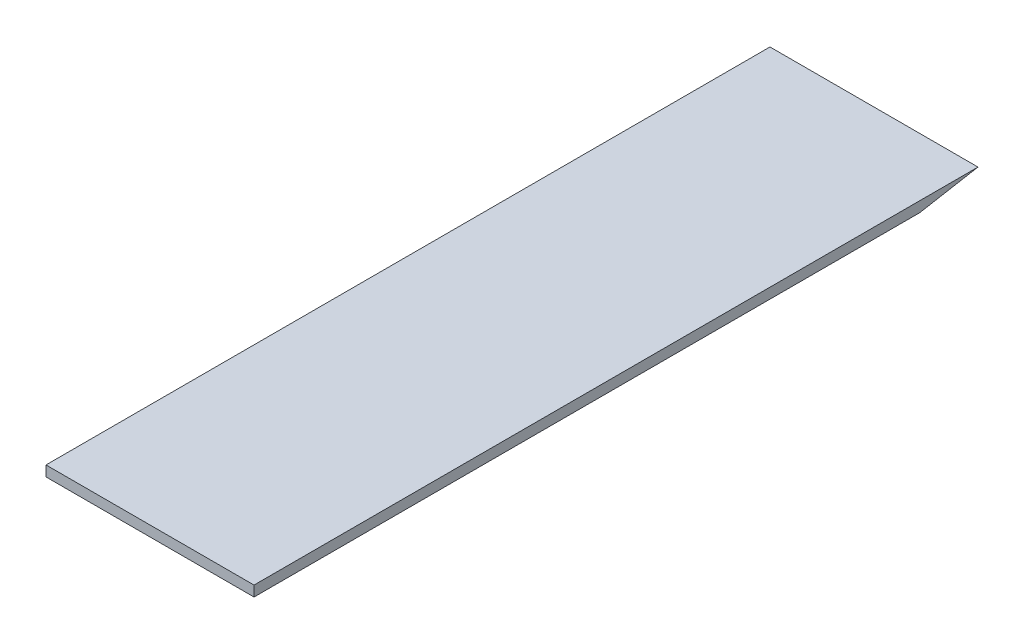
from build123d import *

# Parameters (mm, degrees)
BOSS_EXTRUDE1_DEPTH = 100


with BuildPart() as part:
    # Sketch1 → Boss-Extrude1 (new body)
    with BuildSketch(Plane(origin=(0, 0, 0), x_dir=(0, 0, -1), z_dir=(1, 0, 0))):
        Polygon((0, 5), (0, 0), (320, 0), (348, 5), align=None)
    extrude(amount=BOSS_EXTRUDE1_DEPTH)


solid = part.part
